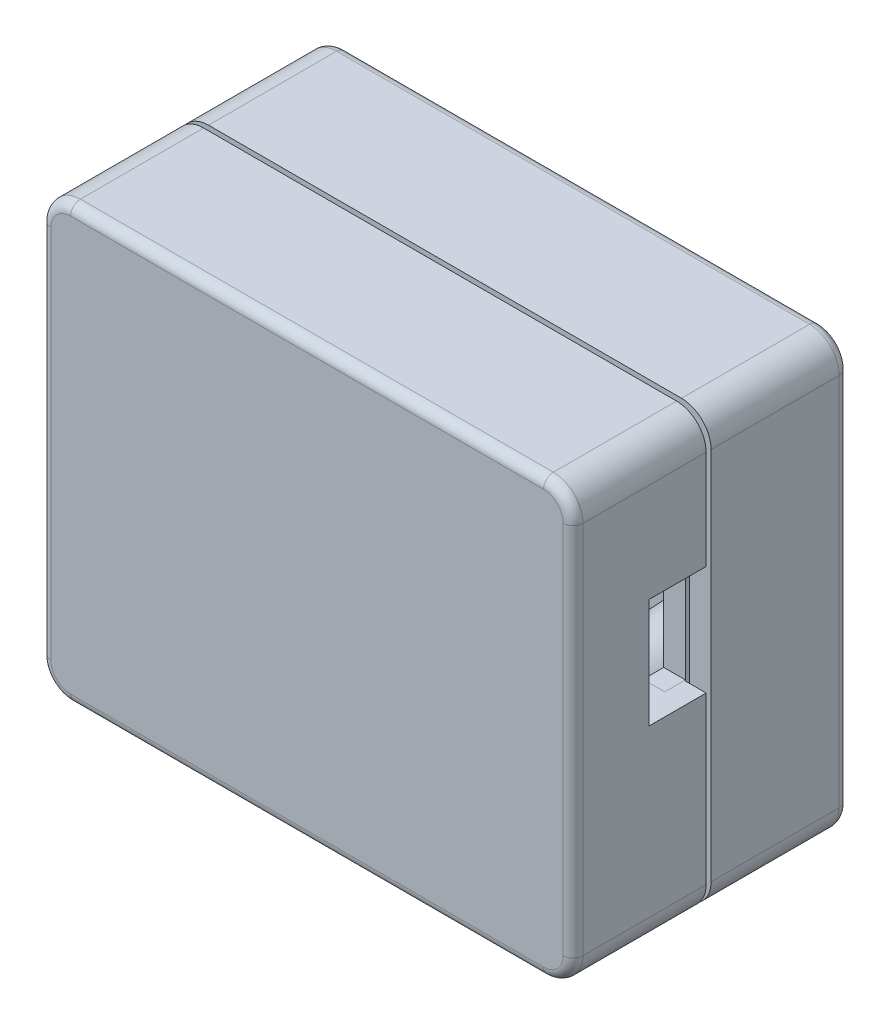
from build123d import *

# Parameters (mm, degrees)
SKETCH1_W                   = 27
SKETCH1_H                   = 22
BOSS_EXTRUDE1_DEPTH         = 7
FILLET1_R                   = 1.5
SHELL1_T                    = 2.2
SKETCH4_W                   = 8.606
SKETCH4_H                   = 14.25
CUT_EXTRUDE1_DEPTH          = 10
SKETCH3_W                   = 2.96
SKETCH3_H                   = 5.56
CUT_EXTRUDE2_DEPTH          = 10
FILLET2_R                   = 0.5
FILLET3_R                   = 0.5
SKETCH5_W                   = 2
SKETCH5_H                   = 1
BOSS_EXTRUDE2_DEPTH         = 4.53
SKETCH5_3_W                 = 2
SKETCH5_3_H                 = 1
BOSS_EXTRUDE3_DEPTH         = 5.48
SKETCH6_W                   = 2
SKETCH6_H                   = 2
BOSS_EXTRUDE4_DEPTH         = 4.12
LIP_GROOVE2_GROOVE_DEPTH    = 1.25
LIP_GROOVE2_GROOVE_2_DEPTH  = 0.25
LIP_GROOVE2_LIP_START       = -12.4
LIP_GROOVE2_LIP_OUTLINE_W   = 1.1
LIP_GROOVE2_LIP_OUTLINE_H   = 1.25
LIP_GROOVE2_LIP_DEPTH       = 24.8
LIP_GROOVE2_LIP_START_2     = 11.3
LIP_GROOVE2_LIP_2_OUTLINE_W = 17.6
LIP_GROOVE2_LIP_2_OUTLINE_H = 1.25
LIP_GROOVE2_LIP_2_DEPTH     = 1.1
LIP_GROOVE2_LIP_3_OUTLINE_W = 1.675
LIP_GROOVE2_LIP_3_OUTLINE_H = 1.25
LIP_GROOVE2_LIP_3_DEPTH     = 1.1
SKETCH11_W                  = 6
SKETCH11_H                  = 1.25
BOSS_EXTRUDE5_DEPTH         = 9.1
BOSS_EXTRUDE6_DEPTH         = 6
CUT_EXTRUDE3_START          = -3
CUT_EXTRUDE3_DEPTH          = 6
SKETCH3_3_W                 = 2.96
SKETCH3_3_H                 = 5.56
CUT_EXTRUDE4_DEPTH          = 10
SKETCH14_R                  = 2.375
SKETCH14_R_2                = 1.375
BOSS_EXTRUDE7_DEPTH         = 4.12


# Read off the part's stored shape, not the designer's step: Mounting Boss1, Lip&Groove2-Groove, Lip&Groove2-Lip, Cut-Extrude3
with BuildPart() as part:
    # Sketch1 → Boss-Extrude1 (new, symmetric)
    with BuildSketch(Plane.XY):
        Rectangle(SKETCH1_W, SKETCH1_H)
    extrude(amount=BOSS_EXTRUDE1_DEPTH, both=True)

    # Fillet1
    fillet1_edges = [part.edges().sort_by_distance(p)[0] for p in [
        (-13.5, 11, 0),
        (13.5, 11, 0),
        (13.5, -11, 0),
        (-13.5, -11, 0),
    ]]
    fillet(fillet1_edges, radius=FILLET1_R)

    # Shell1 (no face opened: a closed hollow body)
    add(offset(amount=-SHELL1_T, mode=Mode.PRIVATE), mode=Mode.SUBTRACT)


with BuildPart() as body_2:
    # Split1: the piece on the far side of the plane
    add(part.part)
    split(bisect_by=Plane.XY, keep=Keep.BOTTOM)

    # Mounting Boss1 outline → Mounting Boss1 (revolve)
    with BuildSketch(Plane(origin=(8.225, -4.225, 0), x_dir=(1, 0, 0), z_dir=(0, -1, 0))):
        Polygon((2, -0.27), (1.25, -0.27), (1.228181169, 0.98), (0, 0.98), (0, -4.8), (2.158191086, -4.8), align=None)
    revolve(axis=Axis((8.225, -4.225, 0), (0, 0, 1)))


with BuildPart() as part_1:
    add(part.part)

    # Split1
    split(bisect_by=Plane.XY, keep=Keep.TOP)


with BuildPart() as cut_extrude1_tool:
    # Sketch4 → Cut-Extrude1 (new body)
    with BuildSketch(Plane.ZY.offset(13.5)):
        with Locations((0.205, 0)):
            Rectangle(SKETCH4_W, SKETCH4_H)
    extrude(amount=-CUT_EXTRUDE1_DEPTH)


with BuildPart() as part_2:
    add(part_1.part)

    # Cut-Extrude1: cut by cut_extrude1_tool
    add(cut_extrude1_tool.part, mode=Mode.SUBTRACT)

    # Sketch3 → Cut-Extrude2 (cut)
    with BuildSketch(Plane(origin=(13.5, 0, 0), x_dir=(0, 0, -1), z_dir=(1, 0, 0))):
        with Locations((-1.68, 1.7)):
            Rectangle(SKETCH3_W, SKETCH3_H)
    extrude(amount=-CUT_EXTRUDE2_DEPTH, mode=Mode.SUBTRACT)

    # Fillet2
    fillet2_edges = [part_2.edges().sort_by_distance(p)[0] for p in [
        (-13.5, 0, 7),
        (0, 11, 7),
        (0, -11, 7),
        (13.5, 0, 7),
        (-13.060660172, -10.560660172, 7),
        (13.060660172, -10.560660172, 7),
        (13.060660172, 10.560660172, 7),
        (-13.060660172, 10.560660172, 7),
    ]]
    fillet(fillet2_edges, radius=FILLET2_R)

    # Sketch6 → Boss-Extrude4 (add)
    with BuildSketch(Plane(origin=(0, 0, 4.8), x_dir=(-1, 0, 0), z_dir=(0, 0, -1))):
        with Locations((4.5, 7)):
            Rectangle(SKETCH6_W, SKETCH6_H)
    boss_extrude4 = extrude(amount=BOSS_EXTRUDE4_DEPTH)

    # Mirror3: Boss-Extrude4 across plane
    add(boss_extrude4.mirror(Plane.ZX))

    # Lip&Groove2-Groove outline → Lip&Groove2-Groove (cut)
    with BuildSketch(Plane.XY):
        Polygon((-12.4, -9.9), (12.4, -9.9), (12.4, -1.08), (13.5, -1.08), (13.5, 4.48), (12.4, 4.48), (12.4, 9.9), (-12.4, 9.9), (-12.4, 7.125), (-11.3, 7.125), (-11.3, 8.8), (11.3, 8.8), (11.3, -8.8), (-11.3, -8.8), (-11.3, -7.125), (-12.4, -7.125), align=None)
    extrude(amount=LIP_GROOVE2_GROOVE_DEPTH, mode=Mode.SUBTRACT)

    # Lip_Groove2-Groove 2 outline → Lip_Groove2-Groove 2 (cut)
    with BuildSketch(Plane.XY):
        with BuildLine():
            Line((12.4, -1.08), (12.4, -9.9))
            Line((12.4, -9.9), (-12.4, -9.9))
            Line((-12.4, -9.9), (-12.4, -7.125))
            Line((-12.4, -7.125), (-13.5, -7.125))
            Line((-13.5, -7.125), (-13.5, -9.5))
            ThreePointArc((-13.5, -9.5), (-13.060660172, -10.560660172), (-12, -11))
            Line((-12, -11), (12, -11))
            ThreePointArc((12, -11), (13.060660172, -10.560660172), (13.5, -9.5))
            Line((13.5, -9.5), (13.5, -1.08))
            Line((13.5, -1.08), (12.4, -1.08))
        make_face()
        with BuildLine():
            Line((12.4, 4.48), (13.5, 4.48))
            Line((13.5, 4.48), (13.5, 9.5))
            ThreePointArc((13.5, 9.5), (13.060660172, 10.560660172), (12, 11))
            Line((12, 11), (-12, 11))
            ThreePointArc((-12, 11), (-13.060660172, 10.560660172), (-13.5, 9.5))
            Line((-13.5, 9.5), (-13.5, 7.125))
            Line((-13.5, 7.125), (-12.4, 7.125))
            Line((-12.4, 7.125), (-12.4, 9.9))
            Line((-12.4, 9.9), (12.4, 9.9))
            Line((12.4, 9.9), (12.4, 4.48))
        make_face()
    extrude(amount=LIP_GROOVE2_GROOVE_2_DEPTH, mode=Mode.SUBTRACT)

    # Sketch11 → Boss-Extrude5 (add)
    with BuildSketch(Plane(origin=(0, 0, 4.8), x_dir=(-1, 0, 0), z_dir=(0, 0, -1))):
        with Locations((0, -8.175)):
            Rectangle(SKETCH11_W, SKETCH11_H)
    boss_extrude5 = extrude(amount=BOSS_EXTRUDE5_DEPTH)

    # Sketch12 → Boss-Extrude6 (add)
    with BuildSketch(Plane.ZY.offset(3)):
        Polygon((-4.3, -8.8), (-4.05, -9.05), (-3.3, -9.05), (-3.05, -8.8), align=None)
    boss_extrude6 = extrude(amount=-BOSS_EXTRUDE6_DEPTH)

    # Mirror5: Boss-Extrude5, Boss-Extrude6 across plane
    add(boss_extrude5.mirror(Plane.ZX))
    add(boss_extrude6.mirror(Plane.ZX))

    # Sketch14 → Boss-Extrude7 (add)
    with BuildSketch(Plane(origin=(0, 0, 4.8), x_dir=(-1, 0, 0), z_dir=(0, 0, -1))):
        with Locations((-8.225, -4.225)):
            Circle(SKETCH14_R)
        with Locations((-8.225, -4.225)):
            Circle(SKETCH14_R_2, mode=Mode.SUBTRACT)
    extrude(amount=BOSS_EXTRUDE7_DEPTH)


with BuildPart() as body_2_1:
    add(body_2.part)

    # Cut-Extrude1: cut by cut_extrude1_tool
    add(cut_extrude1_tool.part, mode=Mode.SUBTRACT)

    # Fillet3
    fillet3_edges = [body_2_1.edges().sort_by_distance(p)[0] for p in [
        (-13.5, 0, -7),
        (0, -11, -7),
        (13.5, 0, -7),
        (0, 11, -7),
        (-13.060660172, -10.560660172, -7),
        (13.060660172, -10.560660172, -7),
        (13.060660172, 10.560660172, -7),
        (-13.060660172, 10.560660172, -7),
    ]]
    fillet(fillet3_edges, radius=FILLET3_R)

    # Sketch5 → Boss-Extrude2 (add)
    with BuildSketch(Plane.XY.offset(-4.8)):
        with Locations((-4.5, 7.5)):
            Rectangle(SKETCH5_W, SKETCH5_H)
        with Locations((-4.5, 6.5)):
            Rectangle(SKETCH5_W, SKETCH5_H)
    boss_extrude2 = extrude(amount=BOSS_EXTRUDE2_DEPTH)

    # Sketch5<3> → Boss-Extrude3 (add)
    with BuildSketch(Plane.XY.offset(-4.8)):
        with Locations((-4.5, 7.5)):
            Rectangle(SKETCH5_3_W, SKETCH5_3_H)
    boss_extrude3 = extrude(amount=BOSS_EXTRUDE3_DEPTH)

    # Mirror2: Boss-Extrude2, Boss-Extrude3 across plane
    add(boss_extrude2.mirror(Plane.ZX))
    add(boss_extrude3.mirror(Plane.ZX))

    # Lip&Groove2-Lip outline → Lip&Groove2-Lip (add)
    with BuildSketch(Plane.YZ.offset(LIP_GROOVE2_LIP_START)):
        with Locations((-9.35, 0.625)):
            Rectangle(LIP_GROOVE2_LIP_OUTLINE_W, LIP_GROOVE2_LIP_OUTLINE_H)
        with Locations((9.35, 0.625)):
            Rectangle(LIP_GROOVE2_LIP_OUTLINE_W, LIP_GROOVE2_LIP_OUTLINE_H)
    extrude(amount=LIP_GROOVE2_LIP_DEPTH)

    # Lip_Groove2-Lip 2 outline → Lip_Groove2-Lip 2 (add)
    with BuildSketch(Plane.YZ.offset(LIP_GROOVE2_LIP_START_2)):
        with Locations((0, 0.625)):
            Rectangle(LIP_GROOVE2_LIP_2_OUTLINE_W, LIP_GROOVE2_LIP_2_OUTLINE_H)
    extrude(amount=LIP_GROOVE2_LIP_2_DEPTH)

    # Lip_Groove2-Lip 3 outline → Lip_Groove2-Lip 3 (add)
    with BuildSketch(Plane.YZ.offset(LIP_GROOVE2_LIP_START)):
        with Locations((-7.9625, 0.625)):
            Rectangle(LIP_GROOVE2_LIP_3_OUTLINE_W, LIP_GROOVE2_LIP_3_OUTLINE_H)
        with Locations((7.9625, 0.625)):
            Rectangle(LIP_GROOVE2_LIP_3_OUTLINE_W, LIP_GROOVE2_LIP_3_OUTLINE_H)
    extrude(amount=LIP_GROOVE2_LIP_3_DEPTH)

    # Cut-Extrude3 outline → Cut-Extrude3 (cut)
    with BuildSketch(Plane.YZ.offset(CUT_EXTRUDE3_START)):
        Polygon((-9.05, -3.3), (-9.05, -4.05), (-8.8, -4.3), (-8.8, -3.05), align=None)
    cut_extrude3 = extrude(amount=CUT_EXTRUDE3_DEPTH, mode=Mode.SUBTRACT)

    # Mirror6: Cut-Extrude3 across plane
    add(cut_extrude3.mirror(Plane.ZX), mode=Mode.SUBTRACT)

    # Sketch3<3> → Cut-Extrude4 (cut)
    with BuildSketch(Plane(origin=(13.5, 0, 0), x_dir=(0, 0, -1), z_dir=(1, 0, 0))):
        with Locations((-1.68, 1.7)):
            Rectangle(SKETCH3_3_W, SKETCH3_3_H)
    extrude(amount=-CUT_EXTRUDE4_DEPTH, mode=Mode.SUBTRACT)


solid = Compound([part_2.part, body_2_1.part])
